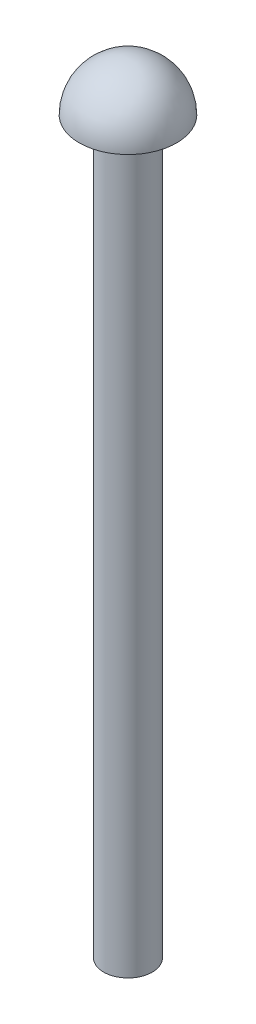
from build123d import *

# Parameters (mm, degrees)
SKETCH1_R           = 1.5
BOSS_EXTRUDE1_DEPTH = 45
REVOLVE1_ANGLE      = 180


with BuildPart() as part:
    # Sketch1 → Boss-Extrude1 (new body)
    with BuildSketch(Plane(origin=(0, 0, 0), x_dir=(1, 0, 0), z_dir=(0, 1, 0))):
        Circle(SKETCH1_R)
    extrude(amount=BOSS_EXTRUDE1_DEPTH)


with BuildPart() as body_2:
    # Sketch4 → Revolve1 (revolve)
    with BuildSketch(Plane(origin=(0, 45, 0), x_dir=(1, 0, 0), z_dir=(0, 1, 0))):
        with BuildLine():
            ThreePointArc((3, 0), (2.121320344, 2.121320344), (0, 3))
            Line((0, 3), (0, 1.5))
            ThreePointArc((0, 1.5), (1.060660172, 1.060660172), (1.5, 0))
            ThreePointArc((1.5, 0), (1.060660172, -1.060660172), (0, -1.5))
            Line((0, -1.5), (0, -3))
            ThreePointArc((0, -3), (2.121320344, -2.121320344), (3, 0))
        make_face()
    revolve(axis=Axis((0, 45, -3), (0, 0, 1)), revolution_arc=REVOLVE1_ANGLE)


solid = Compound([part.part, body_2.part])
